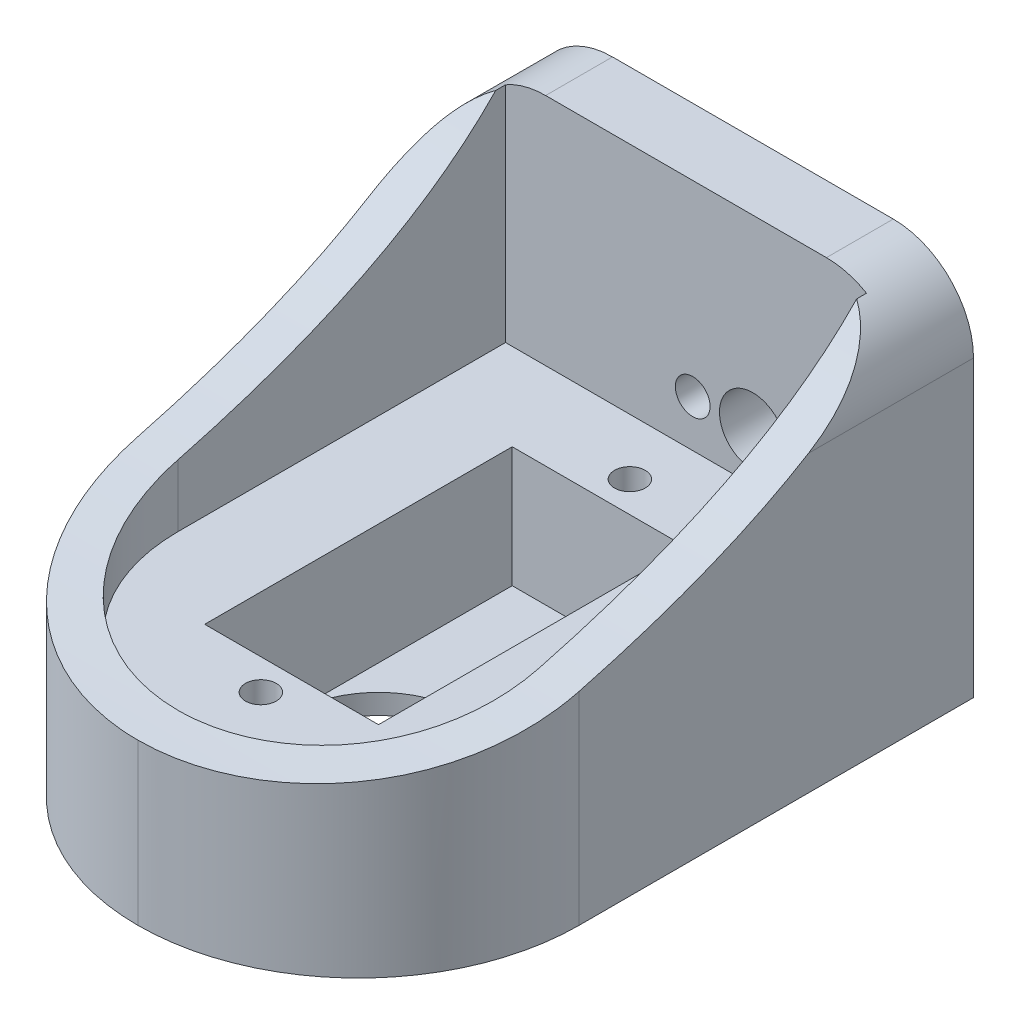
from build123d import *

# Parameters (mm, degrees)
SKETCH2_W               = 33
SKETCH2_H               = 28
BOSS_EXTRUDE1_DEPTH     = 46
CUT_EXTRUDE1_DEPTH      = 59.318093247
CUT_EXTRUDE1_DEPTH_BACK = 59.318093247
SKETCH3_W               = 41
SKETCH3_H               = 17.5
BOSS_EXTRUDE2_DEPTH     = 3
BOSS_EXTRUDE3_DEPTH     = 27
FILLET2_START           = -3.5
FILLET2_DEPTH           = 4.654998639
FILLET2_START_2         = -13.5
FILLET2_2_DEPTH         = 27
FILLET3_R               = 16.5
FILLET4_R               = 6
SKETCH6_W               = 13
SKETCH6_H               = 23
CUT_EXTRUDE2_DEPTH      = 9
SKETCH7_R               = 6.5
CUT_EXTRUDE3_DEPTH      = 9
SKETCH8_R               = 1.15
CUT_EXTRUDE4_DEPTH      = 8
SKETCH9_R               = 1.3
SKETCH9_R_2             = 2.5
CUT_EXTRUDE5_DEPTH      = 47.360004954


with BuildPart() as part:
    # Sketch2 → Boss-Extrude1 (new body)
    with BuildSketch(Plane.XY):
        Rectangle(SKETCH2_W, SKETCH2_H)
    extrude(amount=BOSS_EXTRUDE1_DEPTH)

    # Sketch3 → Cut-Extrude1 (cut, two sides: drawn at the far end of the back side and taken through both)
    with BuildSketch(Plane.ZY.offset(16.5).offset(-CUT_EXTRUDE1_DEPTH_BACK)):
        with Locations((25.5, 5.25)):
            Rectangle(SKETCH3_W, SKETCH3_H)
    extrude(amount=CUT_EXTRUDE1_DEPTH + CUT_EXTRUDE1_DEPTH_BACK, mode=Mode.SUBTRACT)

    # Sketch4 → Boss-Extrude2 (add)
    with BuildSketch(Plane.ZY.offset(16.5)):
        with BuildLine():
            Line((46, -2), (46, -3.5))
            Line((46, -3.5), (5, -3.5))
            Line((5, -3.5), (5, 14))
            add(Edge.make_bspline(
                [(5, 14), (15.432246661, 2.101110375), (46, -2)],
                knots=[0, 0, 0, 1, 1, 1], degree=2))
        make_face()
    boss_extrude2 = extrude(amount=-BOSS_EXTRUDE2_DEPTH)

    # Mirror1: Boss-Extrude2 across plane
    add(boss_extrude2.mirror(Plane(origin=(0, 0, 0), x_dir=(0, 0, 1), z_dir=(1, 0, 0))))

    # Sketch5 → Boss-Extrude3 (add)
    with BuildSketch(Plane(origin=(-13.5, 0, 0), x_dir=(0, 0, -1), z_dir=(1, 0, 0))):
        with BuildLine():
            Line((-46, -3.5), (-43, -3.5))
            Line((-43, -3.5), (-43, -1.57137225))
            add(Edge.make_bspline(
                [(-43, -1.57137225), (-44.474940132, -1.795390955), (-46.000000067, -2.000000009)],
                knots=[0.950108864, 0.950108864, 0.950108864, 1, 1, 1], degree=2))
            Line((-46.000000067, -2.000000009), (-46, -3.5))
        make_face()
    extrude(amount=BOSS_EXTRUDE3_DEPTH)

    # Fillet2: read off the stored shape, not the designer's step
    # Fillet2 outline → Fillet2 (add)
    with BuildSketch(Plane(origin=(0, 0, 0), x_dir=(1, 0, 0), z_dir=(0, 1.0, -9.82210297214819e-12)).offset(FILLET2_START)):
        with BuildLine():
            Line((13.5, -43.00000001), (13.5, -29.5))
            ThreePointArc((13.5, -29.5), (9.545941546, -39.045941546), (0, -43))
            Line((0, -43), (13.5, -43.00000001))
        make_face()
        with BuildLine():
            Line((-13.5, -43), (0, -43))
            ThreePointArc((0, -43), (-9.545941546, -39.045941546), (-13.5, -29.5))
            Line((-13.5, -29.5), (-13.5, -43))
        make_face()
    extrude(amount=FILLET2_DEPTH)

    # Fillet2 2 outline → Fillet2 2 (cut)
    with BuildSketch(Plane.YZ.offset(FILLET2_START_2)):
        with BuildLine():
            Line((1.154998639, 43.000000001), (-1.57137225, 43.000000001))
            add(Edge.make_bspline(
                [(-1.57137225, 43.000000001), (-0.450949941, 35.623134616), (1.154998546, 29.499999976)],
                knots=[0.049891135, 0.049891135, 0.049891135, 0.299420037, 0.299420037, 0.299420037], degree=2))
            Line((1.154998546, 29.499999976), (1.154998639, 43.000000001))
        make_face()
    extrude(amount=FILLET2_2_DEPTH, mode=Mode.SUBTRACT)

    # Fillet3
    # the kernel refuses this fillet: 16.5 mm, written as the material it takes off along each edge
    with BuildSketch(Plane(origin=(-16.5, -55.25, 46), x_dir=(0, 0, -1), z_dir=(0, 1, 0)), Plane(origin=(16.5, 39.25, 46), x_dir=(0, 0, -1), z_dir=(0, -1, 0))) as fillet3_piece_1:
        with BuildLine():
            CenterArc((FILLET3_R, -FILLET3_R), FILLET3_R, 90, 90)
            Line((0, -FILLET3_R), (0, 0))
            Line((0, 0), (FILLET3_R, 0))
        make_face()
    extrude(amount=94.5, mode=Mode.SUBTRACT)

    # Fillet4
    # the kernel refuses this fillet: 6 mm, written as the material it takes off along each edge
    with BuildSketch(Plane(origin=(-16.5, 14, -15), x_dir=(1, 0, 0), z_dir=(0, 0, 1))) as fillet4_piece_1:
        with BuildLine():
            CenterArc((FILLET4_R, -FILLET4_R), FILLET4_R, 90, 90)
            Line((0, -FILLET4_R), (0, 0))
            Line((0, 0), (FILLET4_R, 0))
        make_face()
    extrude(amount=35, mode=Mode.SUBTRACT)
    with BuildSketch(Plane(origin=(16.5, 14, -15), x_dir=(-1, 0, 0), z_dir=(0, 0, 1))) as fillet4_piece_2:
        with BuildLine():
            CenterArc((FILLET4_R, FILLET4_R), FILLET4_R, 180, 90)
            Line((0, FILLET4_R), (0, 0))
            Line((0, 0), (FILLET4_R, 0))
        make_face()
    extrude(amount=35, mode=Mode.SUBTRACT)

    # Sketch6 → Cut-Extrude2 (cut)
    with BuildSketch(Plane(origin=(0, -3.5, 0), x_dir=(1, 0, 0), z_dir=(0, 1, 0))):
        with Locations((0, -23)):
            Rectangle(SKETCH6_W, SKETCH6_H)
    extrude(amount=-CUT_EXTRUDE2_DEPTH, mode=Mode.SUBTRACT)

    # Sketch7 → Cut-Extrude3 (cut)
    with BuildSketch(Plane(origin=(0, -12.5, 0), x_dir=(1, 0, 0), z_dir=(0, 1, 0))):
        with Locations(Location((0, -28, 0), (0, 0, 270))):
            Circle(SKETCH7_R)
    extrude(amount=-CUT_EXTRUDE3_DEPTH, mode=Mode.SUBTRACT)

    # Sketch8 → Cut-Extrude4 (cut)
    with BuildSketch(Plane(origin=(0, -3.5, 0), x_dir=(1, 0, 0), z_dir=(0, 1, 0))):
        with Locations(Location((0, -9.2, 0), (0, 0, 180))):
            Circle(SKETCH8_R)
        with Locations(Location((0, -36.8, 0), (0, 0, 180))):
            Circle(SKETCH8_R)
    extrude(amount=-CUT_EXTRUDE4_DEPTH, mode=Mode.SUBTRACT)

    # Sketch9 → Cut-Extrude5 (cut, through all)
    with BuildSketch(Plane.XY.offset(5)):
        with Locations((0.5, 0)):
            Circle(SKETCH9_R)
        with Locations((5, 0)):
            Circle(SKETCH9_R_2)
        with Locations((9.5, 0)):
            Circle(SKETCH9_R)
    extrude(amount=-CUT_EXTRUDE5_DEPTH, mode=Mode.SUBTRACT)


solid = part.part
